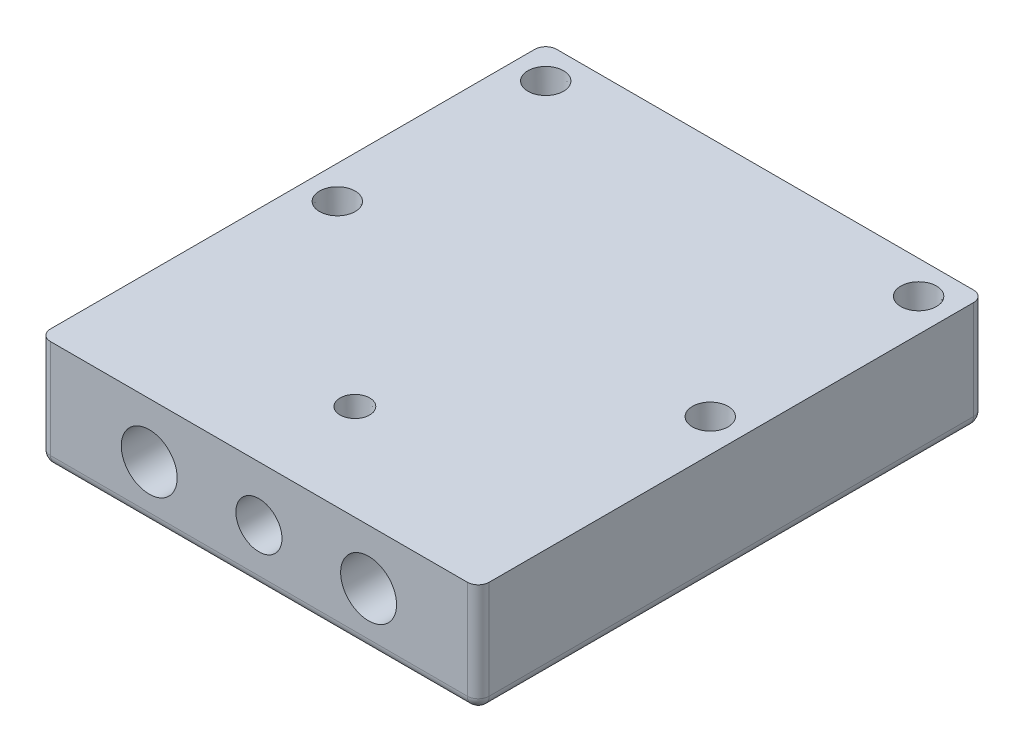
from build123d import *
from OCP.BRepFilletAPI import BRepFilletAPI_MakeChamfer

# Parameters (mm, degrees)
SKETCH1_W                 = 80
SKETCH1_H                 = 92.3
BOSS_EXTRUDE1_DEPTH       = 20
HOLE1_D                   = 5.8
HOLE1_CBORE_D             = 6.5
HOLE1_CBORE_DEPTH         = 6
CHAMFER1_SIZE             = 6
CHAMFER1_SIZE_2           = 0.35
SKETCH4_R                 = 4.2
SKETCH4_R_2               = 5.1
CUT_EXTRUDE1_DEPTH        = 103.563590031
HOLE2_D                   = 4.8
HOLE2_CBORE_D             = 5.4
HOLE2_CBORE_DEPTH         = 4
CHAMFER2_SIZE2            = 0.3
CHAMFER2_SIZE             = 4
CHAMFER2_OF_MIRROR1_SIZE2 = 0.3
CHAMFER2_OF_MIRROR1_SIZE  = 4
FILLET1_R                 = 2


with BuildPart() as part:
    # Sketch1 → Boss-Extrude1 (new body)
    with BuildSketch(Plane(origin=(0, 0, 0), x_dir=(1, 0, 0), z_dir=(0, 1, 0))):
        Rectangle(SKETCH1_W, SKETCH1_H)
    extrude(amount=BOSS_EXTRUDE1_DEPTH)

    # Hole1 (through all)
    with Locations(Plane(origin=(0, 20, 0), x_dir=(1, 0, 0), z_dir=(0, 1, 0))):
        with Locations((-34, 40.15), (34, 40.15), (34, 2.15), (-34, 2.15)):
            CounterBoreHole(HOLE1_D / 2, HOLE1_CBORE_D / 2, HOLE1_CBORE_DEPTH)

    # Chamfer1
    chamfer1_edges_1 = [part.edges().sort_by_distance(p)[0] for p in [
        (-37.25, 14, -2.15),
    ]]
    chamfer1_side_1 = [part.faces().sort_by_distance(p)[0] for p in [
        (-37.25, 14.007, -2.15),
    ]]
    chamfer1_edges_2 = [part.edges().sort_by_distance(p)[0] for p in [
        (30.75, 14, -2.15),
    ]]
    chamfer1_side_2 = [part.faces().sort_by_distance(p)[0] for p in [
        (30.75, 14.007, -2.15),
    ]]
    chamfer1_edges_3 = [part.edges().sort_by_distance(p)[0] for p in [
        (30.75, 14, -40.15),
    ]]
    chamfer1_side_3 = [part.faces().sort_by_distance(p)[0] for p in [
        (30.75, 14.007, -40.15),
    ]]
    chamfer1_edges_4 = [part.edges().sort_by_distance(p)[0] for p in [
        (-37.25, 14, -40.15),
    ]]
    chamfer1_side_4 = [part.faces().sort_by_distance(p)[0] for p in [
        (-37.25, 14.007, -40.15),
    ]]
    chamfer1 = BRepFilletAPI_MakeChamfer(part.part.solid().wrapped)
    for e in chamfer1_edges_1:
        chamfer1.Add(CHAMFER1_SIZE - 0.0001, CHAMFER1_SIZE_2 - 0.0001, e.wrapped, chamfer1_side_1[0].wrapped)
    for e in chamfer1_edges_2:
        chamfer1.Add(CHAMFER1_SIZE - 0.0001, CHAMFER1_SIZE_2 - 0.0001, e.wrapped, chamfer1_side_2[0].wrapped)
    for e in chamfer1_edges_3:
        chamfer1.Add(CHAMFER1_SIZE - 0.0001, CHAMFER1_SIZE_2 - 0.0001, e.wrapped, chamfer1_side_3[0].wrapped)
    for e in chamfer1_edges_4:
        chamfer1.Add(CHAMFER1_SIZE - 0.0001, CHAMFER1_SIZE_2 - 0.0001, e.wrapped, chamfer1_side_4[0].wrapped)
    add(Compound.cast(chamfer1.Shape()), mode=Mode.REPLACE)  # a hair under: the kernel refuses the full size

    # Sketch4 → Cut-Extrude1 (cut, through all)
    with BuildSketch(Plane.XY.offset(46.15)):
        with Locations((0, 10)):
            Circle(SKETCH4_R)
        with Locations((-20, 10)):
            Circle(SKETCH4_R_2)
        with Locations((20, 10)):
            Circle(SKETCH4_R_2)
    extrude(amount=-CUT_EXTRUDE1_DEPTH, mode=Mode.SUBTRACT)

    # Hole2 (through all)
    with Locations(Plane(origin=(-40, 0, 0), x_dir=(0, 0, 1), z_dir=(0, -1, 0))):
        with Locations((28.65, -40)):
            hole2 = CounterBoreHole(HOLE2_D / 2, HOLE2_CBORE_D / 2, HOLE2_CBORE_DEPTH)

    # Chamfer2
    chamfer2_edges = [part.edges().sort_by_distance(p)[0] for p in [
        (0, 4, 25.95),
    ]]
    chamfer2_side = [part.faces().sort_by_distance(p)[0] for p in [
        (0, 3.994, 25.95),
    ]]
    chamfer(chamfer2_edges, length=CHAMFER2_SIZE - 0.0001, length2=CHAMFER2_SIZE2 - 0.0001, reference=chamfer2_side[0])  # a hair under: the kernel refuses the full size

    # Mirror1: Hole2 across plane
    add(hole2.mirror(Plane.ZX.offset(10)), mode=Mode.SUBTRACT)

    # Chamfer2 of Mirror1
    chamfer2_of_mirror1_edges = [part.edges().sort_by_distance(p)[0] for p in [
        (0, 16, 25.95),
    ]]
    chamfer2_of_mirror1_side = [part.faces().sort_by_distance(p)[0] for p in [
        (0, 16.006, 25.95),
    ]]
    chamfer(chamfer2_of_mirror1_edges, length=CHAMFER2_OF_MIRROR1_SIZE - 0.0001, length2=CHAMFER2_OF_MIRROR1_SIZE2 - 0.0001, reference=chamfer2_of_mirror1_side[0])  # a hair under: the kernel refuses the full size

    # Fillet1
    fillet1_edges = [part.edges().sort_by_distance(p)[0] for p in [
        (0, 0, 46.15),
        (-40, 0, 0),
        (0, 0, -46.15),
        (40, 0, 0),
        (40, 10, 46.15),
        (-40, 10, 46.15),
        (-40, 10, -46.15),
        (40, 10, -46.15),
    ]]
    fillet(fillet1_edges, radius=FILLET1_R)


solid = part.part
